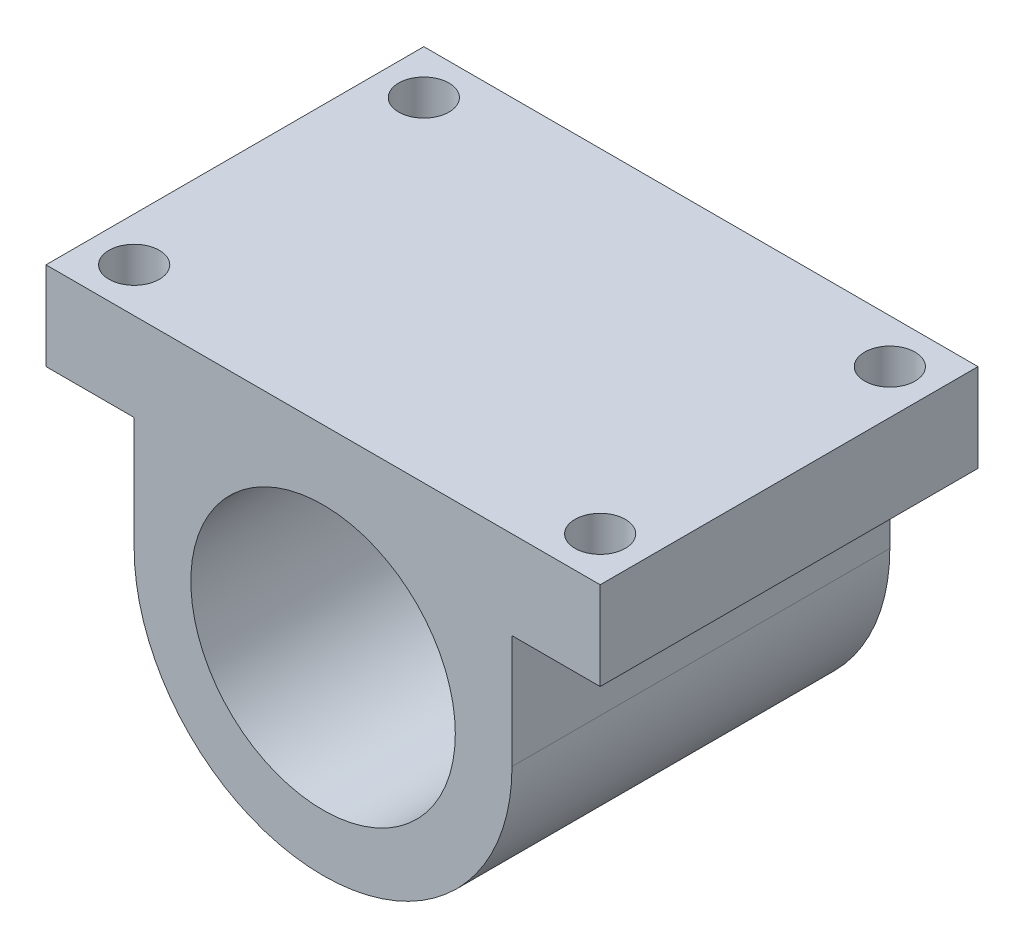
from build123d import *

# Parameters (mm, degrees)
SKETCH_1_W          = 30
SKETCH_1_H          = 31
SKETCH_1_R          = 10.5
EXTRUDE_1_DEPTH     = 30
FILLET_1_R          = 15
FILLET_2_R          = 15
SKETCH_2_W          = 30
SKETCH_2_H          = 7
EXTRUDE_2_DEPTH     = 7
SKETCH_3_W          = 30
SKETCH_3_H          = 7
EXTRUDE_3_DEPTH     = 7
SKETCH_4_R          = 2
CUT_EXTRUDE_1_DEPTH = 7


with BuildPart() as part:
    # Эскиз1 → Бобышка-Вытянуть1 (new body)
    with BuildSketch(Plane.XY):
        with Locations((0, 15.5)):
            Rectangle(SKETCH_1_W, SKETCH_1_H)
        with Locations((0, 15)):
            Circle(SKETCH_1_R, mode=Mode.SUBTRACT)
    extrude(amount=EXTRUDE_1_DEPTH)

    # Скругление1
    fillet_1_edges = [part.edges().sort_by_distance(p)[0] for p in [
        (15, 0, 15),
    ]]
    fillet(fillet_1_edges, radius=FILLET_1_R)

    # Скругление2
    fillet_2_edges = [part.edges().sort_by_distance(p)[0] for p in [
        (-15, 0, 15),
    ]]
    fillet(fillet_2_edges, radius=FILLET_2_R - 0.0001)  # a hair under: the kernel refuses the full size

    # Эскиз2 → Бобышка-Вытянуть2 (add)
    with BuildSketch(Plane(origin=(15, 0, 0), x_dir=(0, 0, -1), z_dir=(1, 0, 0))):
        with Locations((-15, 27.5)):
            Rectangle(SKETCH_2_W, SKETCH_2_H)
    extrude(amount=EXTRUDE_2_DEPTH)

    # Эскиз3 → Бобышка-Вытянуть3 (add)
    with BuildSketch(Plane.ZY.offset(15)):
        with Locations((15, 27.5)):
            Rectangle(SKETCH_3_W, SKETCH_3_H)
    extrude(amount=EXTRUDE_3_DEPTH)

    # Эскиз4 → Вырез-Вытянуть1 (cut)
    with BuildSketch(Plane(origin=(0, 31, 0), x_dir=(1, 0, 0), z_dir=(0, 1, 0))):
        with Locations(Location((18.5, -3.5, 0), (0, 0, 270))):
            Circle(SKETCH_4_R)
        with Locations(Location((18.5, -26.5, 0), (0, 0, 270))):
            Circle(SKETCH_4_R)
        with Locations(Location((-18.5, -26.5, 0), (0, 0, 270))):
            Circle(SKETCH_4_R)
        with Locations(Location((-18.5, -3.5, 0), (0, 0, 270))):
            Circle(SKETCH_4_R)
    extrude(amount=-CUT_EXTRUDE_1_DEPTH, mode=Mode.SUBTRACT)


solid = part.part
